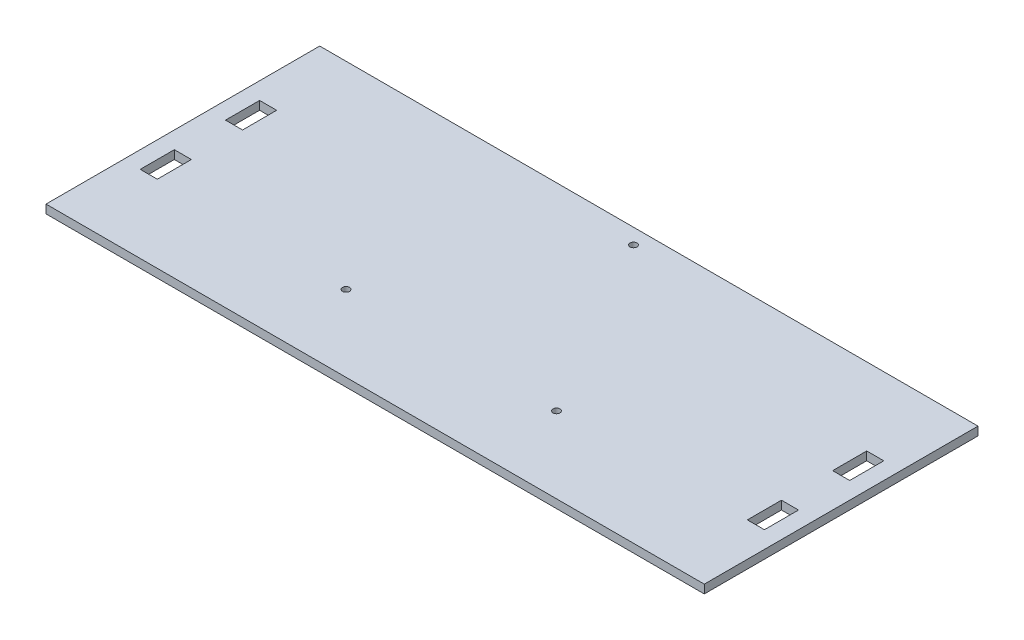
from build123d import *

# Parameters (mm, degrees)
SKETCH_1_W      = 386
SKETCH_1_H      = 160.5
SKETCH_1_R      = 2.05
SKETCH_1_W_2    = 10
SKETCH_1_H_2    = 20
EXTRUDE_1_DEPTH = 5


with BuildPart() as part:
    # 草圖1 → 填料-伸長1 (new body)
    with BuildSketch(Plane(origin=(0, 0, 0), x_dir=(1, 0, 0), z_dir=(0, 1, 0))):
        Rectangle(SKETCH_1_W, SKETCH_1_H)
        with Locations((0, 71.25)):
            Circle(SKETCH_1_R, mode=Mode.SUBTRACT)
        with Locations((61.70431002, -35.625)):
            Circle(SKETCH_1_R, mode=Mode.SUBTRACT)
        with Locations((-61.70431002, -35.625)):
            Circle(SKETCH_1_R, mode=Mode.SUBTRACT)
        with Locations((178, -25)):
            Rectangle(SKETCH_1_W_2, SKETCH_1_H_2, mode=Mode.SUBTRACT)
        with Locations((-178, -25)):
            Rectangle(SKETCH_1_W_2, SKETCH_1_H_2, mode=Mode.SUBTRACT)
        with Locations((-178, 25)):
            Rectangle(SKETCH_1_W_2, SKETCH_1_H_2, mode=Mode.SUBTRACT)
        with Locations((178, 25)):
            Rectangle(SKETCH_1_W_2, SKETCH_1_H_2, mode=Mode.SUBTRACT)
    extrude(amount=EXTRUDE_1_DEPTH)


solid = part.part
